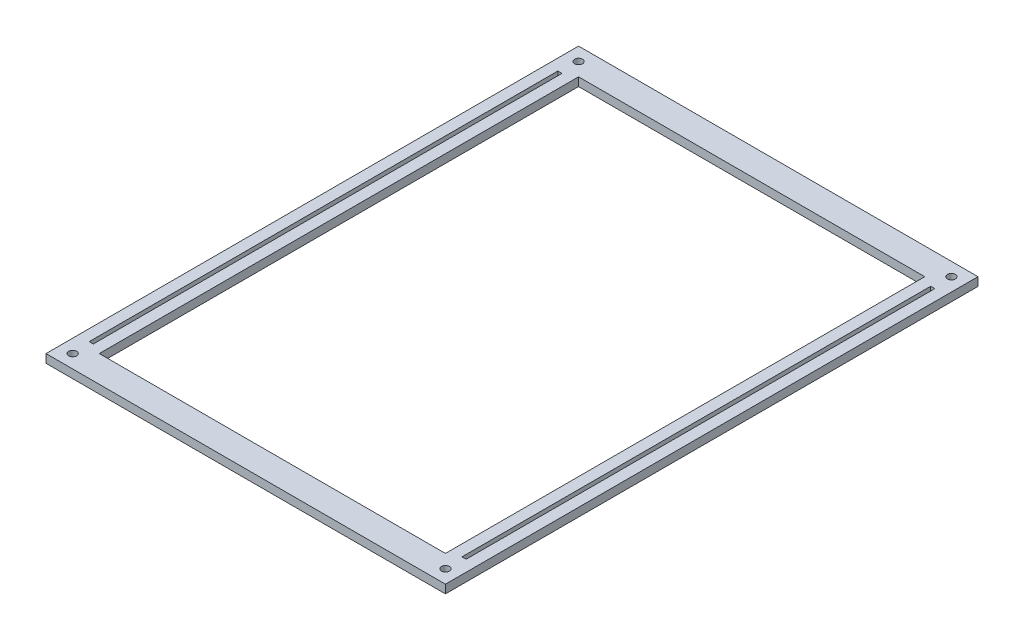
from build123d import *

# Parameters (mm, degrees)
SKETCH1_W          = 150
SKETCH1_H          = 200
SKETCH1_W_2        = 130
SKETCH1_H_2        = 180
MAINBODY_DEPTH     = 1.5875
SHEETLOCK_REACH    = 127.04
SKETCH2_W          = 1.55575
SKETCH2_H          = 176
SUPPORTHOLES_REACH = 127.04
SKETCH3_R          = 1.5


with BuildPart() as part:
    # Sketch1 → MainBody (new, symmetric)
    with BuildSketch(Plane(origin=(0, 0, 0), x_dir=(1, 0, 0), z_dir=(0, 1, 0))):
        Rectangle(SKETCH1_W, SKETCH1_H)
        Rectangle(SKETCH1_W_2, SKETCH1_H_2, mode=Mode.SUBTRACT)
    extrude(amount=MAINBODY_DEPTH, both=True)

    # Sketch2 → SheetLock (cut, up to next)
    with BuildSketch(Plane(origin=(0, 1.5875, 0), x_dir=(1, 0, 0), z_dir=(0, 1, 0)), mode=Mode.PRIVATE) as sheetlock_sk1:
        with Locations((-70, 0)):
            Rectangle(SKETCH2_W, SKETCH2_H)
    sheetlock_tool1 = extrude(sheetlock_sk1.sketch, amount=-SHEETLOCK_REACH, mode=Mode.PRIVATE) & part.part
    sheetlock = sheetlock_tool1.solids().sort_by_distance((-70, 1.5875, 0))[0]
    add(sheetlock, mode=Mode.SUBTRACT)

    # Mirror1: SheetLock across plane
    add(sheetlock.mirror(Plane(origin=(0, 0, 0), x_dir=(0, 0, 1), z_dir=(1, 0, 0))), mode=Mode.SUBTRACT)

    # Sketch3 → SupportHoles (cut, up to next)
    with BuildSketch(Plane(origin=(0, 1.5875, 0), x_dir=(1, 0, 0), z_dir=(0, 1, 0)), mode=Mode.PRIVATE) as supportholes_sk1:
        with Locations((-70, 95)):
            Circle(SKETCH3_R)
    supportholes_tool1 = extrude(supportholes_sk1.sketch, amount=-SUPPORTHOLES_REACH, mode=Mode.PRIVATE) & part.part
    # Sketch3 → SupportHoles (cut, up to next)
    with BuildSketch(Plane(origin=(0, 1.5875, 0), x_dir=(1, 0, 0), z_dir=(0, 1, 0)), mode=Mode.PRIVATE) as supportholes_sk2:
        with Locations((70, 95)):
            Circle(SKETCH3_R)
    supportholes_tool2 = extrude(supportholes_sk2.sketch, amount=-SUPPORTHOLES_REACH, mode=Mode.PRIVATE) & part.part
    # Sketch3 → SupportHoles (cut, up to next)
    with BuildSketch(Plane(origin=(0, 1.5875, 0), x_dir=(1, 0, 0), z_dir=(0, 1, 0)), mode=Mode.PRIVATE) as supportholes_sk3:
        with Locations((70, -95)):
            Circle(SKETCH3_R)
    supportholes_tool3 = extrude(supportholes_sk3.sketch, amount=-SUPPORTHOLES_REACH, mode=Mode.PRIVATE) & part.part
    # Sketch3 → SupportHoles (cut, up to next)
    with BuildSketch(Plane(origin=(0, 1.5875, 0), x_dir=(1, 0, 0), z_dir=(0, 1, 0)), mode=Mode.PRIVATE) as supportholes_sk4:
        with Locations((-70, -95)):
            Circle(SKETCH3_R)
    supportholes_tool4 = extrude(supportholes_sk4.sketch, amount=-SUPPORTHOLES_REACH, mode=Mode.PRIVATE) & part.part
    add(supportholes_tool1.solids().sort_by_distance((-70, 1.5875, -95))[0], mode=Mode.SUBTRACT)
    add(supportholes_tool2.solids().sort_by_distance((70, 1.5875, -95))[0], mode=Mode.SUBTRACT)
    add(supportholes_tool3.solids().sort_by_distance((70, 1.5875, 95))[0], mode=Mode.SUBTRACT)
    add(supportholes_tool4.solids().sort_by_distance((-70, 1.5875, 95))[0], mode=Mode.SUBTRACT)


solid = part.part
